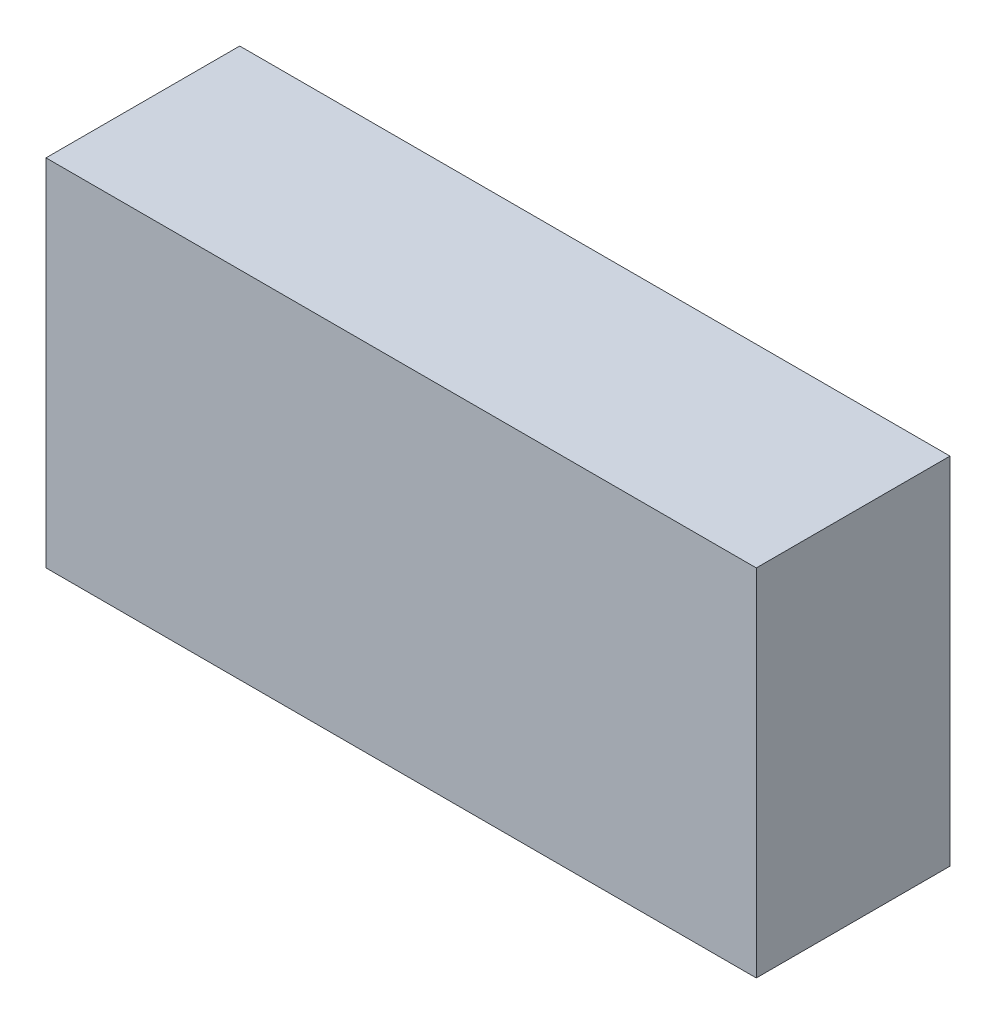
from build123d import *

# Parameters (mm, degrees)
SKETCH1_W           = 110
SKETCH1_H           = 55
BOSS_EXTRUDE1_DEPTH = 30


with BuildPart() as part:
    # Sketch1 → Boss-Extrude1 (new body)
    with BuildSketch(Plane.XY):
        with Locations((5.939349112, -2.928994083)):
            Rectangle(SKETCH1_W, SKETCH1_H)
    extrude(amount=BOSS_EXTRUDE1_DEPTH)


solid = part.part
